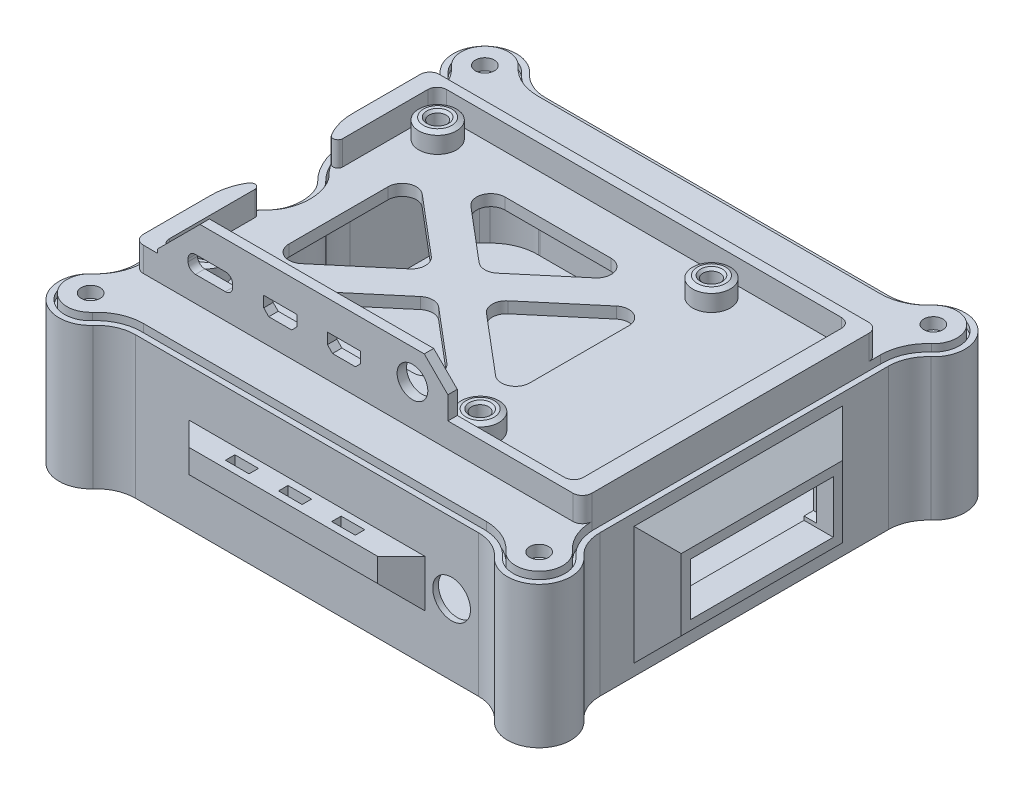
from build123d import *
from OCP.BRepFilletAPI import BRepFilletAPI_MakeChamfer

# Parameters (mm, degrees)
SKETCH2_W                = 95
SKETCH2_H                = 83.5
BACKPLATE_DEPTH          = 2.4
SKETCH4_R                = 5
BOSS_EXTRUDE2_DEPTH      = 2.4
FILLET1_R                = 10
CUT_EXTRUDE2_DEPTH       = 79.841676796
FILLET2_R                = 3
SKETCH7_R                = 4
SKETCH7_R_2              = 1.8
MOUNT_BUMP_DEPTH         = 4
MOUNT_HOLES_DEPTH        = 79.906590346
MOUNT_HOLES_DEPTH_BACK   = 79.906590346
SKETCH7_3_R              = 1.8
OUTER_CHAMFER_SIZE       = 0.5
OUTER_CHAMFER_SIZE2      = 1
INNER_CHAMFER_SIZE       = 0.5
CUT_EXTRUDE4_DEPTH       = 79.906590346
FILLET3_R                = 12
BOSS_EXTRUDE3_DEPTH      = 30
CUT_EXTRUDE5_DEPTH       = 28.4
BOSS_EXTRUDE4_DEPTH      = 27.2
FILLET5_R                = 10
CASING_HOLES_DEPTH       = 88.415616621
CASING_HOLES_DEPTH_BACK  = 88.415616621
SKETCH5_R                = 2
SKETCH12_W               = 34.2
SKETCH12_H               = 15.1
BOSS_EXTRUDE5_DEPTH      = 5
CHAMFER1_SIZE            = 5
CUT_EXTRUDE6_DEPTH       = 5
CUT_EXTRUDE6_DEPTH_BACK  = 1.2
SKETCH12_3_W             = 30.2
SKETCH12_3_H             = 11.1
SKETCH13_W               = 50
SKETCH13_H               = 10
BOSS_EXTRUDE6_DEPTH      = 5
CHAMFER3_SIZE            = 5
SKETCH14_W               = 5
SKETCH14_H               = 2
CUT_EXTRUDE7_DEPTH       = 84.616565505
SKETCH15_R               = 4
CUT_EXTRUDE8_DEPTH       = 1.2
SKETCH19_W               = 61.5
SKETCH19_H               = 2
BOSS_EXTRUDE12_DEPTH     = 15
CUT_EXTRUDE9_DEPTH       = 115.706931076
CUT_EXTRUDE9_DEPTH_BACK  = 115.706931076
SKETCH18_R               = 3
SKETCH18_R_2             = 3.25
CHAMFER4_SIZE            = 9
CHAMFER5_SIZE            = 5
BOSS_EXTRUDE13_DEPTH     = 27.2
FILLET7_R                = 2
BOSS_EXTRUDE22_DEPTH     = 5.2
FILLET8_R                = 1
FILLET9_R                = 2
MIRROR4_START            = -15.1686
MIRROR4_OUTLINE_W        = 5
MIRROR4_OUTLINE_H        = 2
MIRROR4_DEPTH            = 5.1686
MIRROR4_START_2          = -20
MIRROR4_2_OUTLINE_W      = 5
MIRROR4_2_OUTLINE_H      = 2
MIRROR4_2_DEPTH          = 4.8314
MIRROR4_START_3          = -50
MIRROR4_3_DEPTH          = 4.250191257
SKETCH23_W               = 1.7
SKETCH23_H               = 7.5
CUT_EXTRUDE10_DEPTH      = 1
CHAMFER6_SIZE            = 1
CHAMFER6_OF_MIRROR6_SIZE = 1
CHAMFER7_SIZE            = 1


with BuildPart() as part:
    # Sketch2 → Backplate (new body)
    with BuildSketch(Plane(origin=(0, 0, 0), x_dir=(1, 0, 0), z_dir=(0, 1, 0))):
        with Locations((10, 1.25)):
            Rectangle(SKETCH2_W, SKETCH2_H)
    extrude(amount=BACKPLATE_DEPTH)

    # Sketch4 → Boss-Extrude2 (add)
    with BuildSketch(Plane(origin=(0, 2.4, 0), x_dir=(1, 0, 0), z_dir=(0, 1, 0))):
        with Locations((-37.5, 43)):
            Circle(SKETCH4_R)
        with Locations((-37.5, -40.5)):
            Circle(SKETCH4_R)
        with Locations((57.5, -40.5)):
            Circle(SKETCH4_R)
        with Locations((57.5, 43)):
            Circle(SKETCH4_R)
    extrude(amount=-BOSS_EXTRUDE2_DEPTH)

    # Fillet1
    fillet1_edges = [part.edges().sort_by_distance(p)[0] for p in [
        (57.5, 1.2, -38),
        (52.5, 1.2, -43),
        (-32.5, 1.2, -43),
        (-37.5, 1.2, -38),
        (-32.5, 1.2, 40.5),
        (-37.5, 1.2, 35.5),
        (52.5, 1.2, 40.5),
        (57.5, 1.2, 35.5),
    ]]
    fillet(fillet1_edges, radius=FILLET1_R)

    # Sketch6 → Cut-Extrude2 (cut, through all)
    with BuildSketch(Plane(origin=(0, 2.4, 0), x_dir=(1, 0, 0), z_dir=(0, 1, 0))):
        Polygon((19.433743065, 21), (0, 4.581837755), (-19.433743065, 21), align=None)
        Polygon((-25.5, 16.961265693), (-5.423399792, 0), (-25.5, -16.961265693), align=None)
        Polygon((19.433743065, -21), (-19.433743065, -21), (0, -4.581837755), align=None)
        Polygon((25.5, 16.961265693), (25.5, -16.961265693), (5.423399792, 0), align=None)
    extrude(amount=-CUT_EXTRUDE2_DEPTH, mode=Mode.SUBTRACT)

    # Fillet2
    fillet2_edges = [part.edges().sort_by_distance(p)[0] for p in [
        (0, 1.2, 4.581837755),
        (19.433743065, 1.2, 21),
        (-19.433743065, 1.2, 21),
        (-25.5, 1.2, 16.961265693),
        (-25.5, 1.2, -16.961265693),
        (-5.423399792, 1.2, 0),
        (5.423399792, 1.2, 0),
        (25.5, 1.2, -16.961265693),
        (25.5, 1.2, 16.961265693),
        (-19.433743065, 1.2, -21),
        (19.433743065, 1.2, -21),
        (0, 1.2, -4.581837755),
    ]]
    fillet(fillet2_edges, radius=FILLET2_R)

    # Sketch7 → Mount Bump (add)
    # profile 1 of 8: a face of its own
    with BuildSketch(Plane(origin=(0, 2.4, 0), x_dir=(1, 0, 0), z_dir=(0, 1, 0))):
        with Locations(Location((-29, 24.5, 0), (0, 0, 270))):
            Circle(SKETCH7_R)
        with Locations((-29, 24.5)):
            Circle(SKETCH7_R_2, mode=Mode.SUBTRACT)
    # profile 2 of 8: a face of its own
    with BuildSketch(Plane(origin=(0, 2.4, 0), x_dir=(1, 0, 0), z_dir=(0, 1, 0))):
        with Locations((-29, 24.5)):
            Circle(SKETCH7_R_2)
    # profile 3 of 8: a face of its own
    with BuildSketch(Plane(origin=(0, 2.4, 0), x_dir=(1, 0, 0), z_dir=(0, 1, 0))):
        with Locations(Location((29, 24.5, 0), (0, 0, 270))):
            Circle(SKETCH7_R)
        with Locations((29, 24.5)):
            Circle(SKETCH7_R_2, mode=Mode.SUBTRACT)
    # profile 4 of 8: a face of its own
    with BuildSketch(Plane(origin=(0, 2.4, 0), x_dir=(1, 0, 0), z_dir=(0, 1, 0))):
        with Locations((29, 24.5)):
            Circle(SKETCH7_R_2)
    # profile 5 of 8: a face of its own
    with BuildSketch(Plane(origin=(0, 2.4, 0), x_dir=(1, 0, 0), z_dir=(0, 1, 0))):
        with Locations(Location((29, -24.5, 0), (0, 0, 270))):
            Circle(SKETCH7_R)
        with Locations((29, -24.5)):
            Circle(SKETCH7_R_2, mode=Mode.SUBTRACT)
    # profile 6 of 8: a face of its own
    with BuildSketch(Plane(origin=(0, 2.4, 0), x_dir=(1, 0, 0), z_dir=(0, 1, 0))):
        with Locations((29, -24.5)):
            Circle(SKETCH7_R_2)
    # profile 7 of 8: a face of its own
    with BuildSketch(Plane(origin=(0, 2.4, 0), x_dir=(1, 0, 0), z_dir=(0, 1, 0))):
        with Locations(Location((-29, -24.5, 0), (0, 0, 270))):
            Circle(SKETCH7_R)
        with Locations((-29, -24.5)):
            Circle(SKETCH7_R_2, mode=Mode.SUBTRACT)
    # profile 8 of 8: a face of its own
    with BuildSketch(Plane(origin=(0, 2.4, 0), x_dir=(1, 0, 0), z_dir=(0, 1, 0))):
        with Locations((-29, -24.5)):
            Circle(SKETCH7_R_2)
    extrude(amount=MOUNT_BUMP_DEPTH)

    # Sketch7<3> → Mount Holes (cut, two sides: drawn at the far end of the back side and taken through both)
    with BuildSketch(Plane(origin=(0, 2.4, 0), x_dir=(1, 0, 0), z_dir=(0, 1, 0)).offset(-MOUNT_HOLES_DEPTH_BACK)):
        with Locations(Location((-29, 24.5, 0), (0, 0, 270))):
            Circle(SKETCH7_3_R)
        with Locations(Location((29, 24.5, 0), (0, 0, 270))):
            Circle(SKETCH7_3_R)
        with Locations(Location((-29, -24.5, 0), (0, 0, 270))):
            Circle(SKETCH7_3_R)
        with Locations(Location((29, -24.5, 0), (0, 0, 270))):
            Circle(SKETCH7_3_R)
    extrude(amount=MOUNT_HOLES_DEPTH + MOUNT_HOLES_DEPTH_BACK, mode=Mode.SUBTRACT)

    # Outer Chamfer: one chamfer whose edges measure the first distance from different faces: ONE call of the kernel's chamfer builder (chamfer() names one face for all edges)
    outer_chamfer_edges_1 = [part.edges().sort_by_distance(p)[0] for p in [
        (-29, 6.4, -28.5),
    ]]
    outer_chamfer_side_1 = [part.faces().sort_by_distance(p)[0] for p in [
        (-29, 4.4, -28.5),
    ]]
    outer_chamfer_edges_2 = [part.edges().sort_by_distance(p)[0] for p in [
        (29, 6.4, -28.5),
    ]]
    outer_chamfer_side_2 = [part.faces().sort_by_distance(p)[0] for p in [
        (29, 4.4, -28.5),
    ]]
    outer_chamfer_edges_3 = [part.edges().sort_by_distance(p)[0] for p in [
        (29, 6.4, 20.5),
    ]]
    outer_chamfer_side_3 = [part.faces().sort_by_distance(p)[0] for p in [
        (29, 4.4, 20.5),
    ]]
    outer_chamfer_edges_4 = [part.edges().sort_by_distance(p)[0] for p in [
        (-29, 6.4, 20.5),
    ]]
    outer_chamfer_side_4 = [part.faces().sort_by_distance(p)[0] for p in [
        (-29, 4.4, 20.5),
    ]]
    outer_chamfer = BRepFilletAPI_MakeChamfer(part.part.solid().wrapped)
    for e in outer_chamfer_edges_1:
        outer_chamfer.Add(OUTER_CHAMFER_SIZE, OUTER_CHAMFER_SIZE2, e.wrapped, outer_chamfer_side_1[0].wrapped)  # the first distance lies on this face
    for e in outer_chamfer_edges_2:
        outer_chamfer.Add(OUTER_CHAMFER_SIZE, OUTER_CHAMFER_SIZE2, e.wrapped, outer_chamfer_side_2[0].wrapped)  # the first distance lies on this face
    for e in outer_chamfer_edges_3:
        outer_chamfer.Add(OUTER_CHAMFER_SIZE, OUTER_CHAMFER_SIZE2, e.wrapped, outer_chamfer_side_3[0].wrapped)  # the first distance lies on this face
    for e in outer_chamfer_edges_4:
        outer_chamfer.Add(OUTER_CHAMFER_SIZE, OUTER_CHAMFER_SIZE2, e.wrapped, outer_chamfer_side_4[0].wrapped)  # the first distance lies on this face
    add(Compound.cast(outer_chamfer.Shape()), mode=Mode.REPLACE)

    # Inner Chamfer
    inner_chamfer_edges = [part.edges().sort_by_distance(p)[0] for p in [
        (29, 6.4, -26.3),
        (-29, 6.4, 22.7),
        (29, 6.4, 22.7),
        (-29, 6.4, -26.3),
    ]]
    chamfer(inner_chamfer_edges, length=INNER_CHAMFER_SIZE)

    # Sketch8 → Cut-Extrude4 (cut, through all)
    with BuildSketch(Plane(origin=(0, 2.4, 0), x_dir=(1, 0, 0), z_dir=(0, 1, 0))):
        with BuildLine():
            Line((-37.5, 8), (-37.5, -8))
            add(Edge.make_bspline(
                [(-37.5, -8), (-31.5, -8), (-31.5, 0), (-31.5, 8), (-37.5, 8)],
                knots=[0, 0, 0, 1.570796327, 1.570796327, 3.141592654, 3.141592654, 3.141592654], degree=2, weights=[1, 0.707106781, 1, 0.707106781, 1]))
        make_face()
    extrude(amount=-CUT_EXTRUDE4_DEPTH, mode=Mode.SUBTRACT)

    # Fillet3
    fillet3_edges = [part.edges().sort_by_distance(p)[0] for p in [
        (-37.5, 1.2, -8),
        (-37.5, 1.2, 8),
    ]]
    fillet(fillet3_edges, radius=FILLET3_R)

    # Sketch9 → Boss-Extrude3 (add)
    with BuildSketch(Plane.XZ):
        with BuildLine():
            Line((-39.2, 29.319660113), (-39.2, 14.970010512))
            ThreePointArc((-39.2, 14.970010512), (-38.140047632, 9.68614868), (-35.124204984, 5.219898798))
            add(Edge.make_bspline(
                [(-35.124204984, 5.219898798), (-34.800075465, 4.899954882), (-34.247609195, 4.179715717), (-33.435428649, 2.439932761), (-33.042652724, -0.003661849), (-33.436614863, -2.441235626), (-34.245704751, -4.176554892), (-34.7995401, -4.89942643), (-35.124204984, -5.219898798)],
                knots=[0, 0, 0, 0, 0.125, 0.25, 0.5, 0.75, 0.875, 1, 1, 1, 1], degree=3))
            ThreePointArc((-35.124204984, -5.219898798), (-38.140047632, -9.68614868), (-39.2, -14.970010512))
            Line((-39.2, -14.970010512), (-39.2, -31.819660113))
            ThreePointArc((-39.2, -31.819660113), (-39.923171288, -35.208120923), (-41.966666667, -38.00611485))
            ThreePointArc((-41.966666667, -38.00611485), (-42.237615434, -47.737615434), (-32.50611485, -47.466666667))
            ThreePointArc((-32.50611485, -47.466666667), (-29.708120923, -45.423171288), (-26.319660113, -44.7))
            Line((-26.319660113, -44.7), (46.319660113, -44.7))
            ThreePointArc((46.319660113, -44.7), (49.708120923, -45.423171288), (52.50611485, -47.466666667))
            ThreePointArc((52.50611485, -47.466666667), (62.237615434, -47.737615434), (61.966666667, -38.00611485))
            ThreePointArc((61.966666667, -38.00611485), (59.923171288, -35.208120923), (59.2, -31.819660113))
            Line((59.2, -31.819660113), (59.2, 29.319660113))
            ThreePointArc((59.2, 29.319660113), (59.923171288, 32.708120923), (61.966666667, 35.50611485))
            ThreePointArc((61.966666667, 35.50611485), (62.237615434, 45.237615434), (52.50611485, 44.966666667))
            ThreePointArc((52.50611485, 44.966666667), (49.708120923, 42.923171288), (46.319660113, 42.2))
            Line((46.319660113, 42.2), (-26.319660113, 42.2))
            ThreePointArc((-26.319660113, 42.2), (-29.708120923, 42.923171288), (-32.50611485, 44.966666667))
            ThreePointArc((-32.50611485, 44.966666667), (-42.237615434, 45.237615434), (-41.966666667, 35.50611485))
            ThreePointArc((-41.966666667, 35.50611485), (-39.923171288, 32.708120923), (-39.2, 29.319660113))
        make_face()
    extrude(amount=BOSS_EXTRUDE3_DEPTH)

    # Sketch9<3> → Cut-Extrude5 (cut)
    with BuildSketch(Plane.XZ):
        with BuildLine():
            Line((-38, 29.319660113), (-38, 14.970010512))
            ThreePointArc((-38, 14.970010512), (-37.032890175, 10.148968694), (-34.281208927, 6.073923182))
            add(Edge.make_bspline(
                [(-34.281208927, 6.073923182), (-33.882070628, 5.679939101), (-33.545489342, 5.239618892), (-33.113386916, 4.525238038), (-32.981566085, 4.277171227), (-32.746116399, 3.774543475), (-32.641660281, 3.518752112), (-32.364531222, 2.739149193), (-32.22763268, 2.202975888), (-32.04415127, 1.101320172), (-31.999848962, 0.549657796), (-32.000076092, -0.279008786), (-32.011374122, -0.555428398), (-32.056930017, -1.108671524), (-32.091443397, -1.386707431), (-32.228986281, -2.208162731), (-32.365303217, -2.74136978), (-32.641407613, -3.518016876), (-32.745484197, -3.773005152), (-32.980179564, -4.274398454), (-33.111704673, -4.522262411), (-33.544657767, -5.238630125), (-33.881819308, -5.679691026), (-34.281208927, -6.073923182)],
                knots=[0, 0, 0, 0, 0.125, 0.125, 0.1875, 0.1875, 0.25, 0.25, 0.375, 0.375, 0.5, 0.5, 0.5625, 0.5625, 0.625, 0.625, 0.75, 0.75, 0.8125, 0.8125, 0.875, 0.875, 1, 1, 1, 1], degree=3))
            ThreePointArc((-34.281208927, -6.073923182), (-37.032890175, -10.148968694), (-38, -14.970010512))
            Line((-38, -14.970010512), (-38, -31.819660113))
            ThreePointArc((-38, -31.819660113), (-38.827726173, -35.698018872), (-41.166666667, -38.900542041))
            ThreePointArc((-41.166666667, -38.900542041), (-41.389087297, -46.889087297), (-33.400542041, -46.666666667))
            ThreePointArc((-33.400542041, -46.666666667), (-30.198018872, -44.327726173), (-26.319660113, -43.5))
            Line((-26.319660113, -43.5), (46.319660113, -43.5))
            ThreePointArc((46.319660113, -43.5), (50.198018872, -44.327726173), (53.400542041, -46.666666667))
            ThreePointArc((53.400542041, -46.666666667), (61.389087297, -46.889087297), (61.166666667, -38.900542041))
            ThreePointArc((61.166666667, -38.900542041), (58.827726173, -35.698018872), (58, -31.819660113))
            Line((58, -31.819660113), (58, 29.319660113))
            ThreePointArc((58, 29.319660113), (58.827726173, 33.198018872), (61.166666667, 36.400542041))
            ThreePointArc((61.166666667, 36.400542041), (61.389087297, 44.389087297), (53.400542041, 44.166666667))
            ThreePointArc((53.400542041, 44.166666667), (50.198018872, 41.827726173), (46.319660113, 41))
            Line((46.319660113, 41), (-26.319660113, 41))
            ThreePointArc((-26.319660113, 41), (-30.198018872, 41.827726173), (-33.400542041, 44.166666667))
            ThreePointArc((-33.400542041, 44.166666667), (-41.389087297, 44.389087297), (-41.166666667, 36.400542041))
            ThreePointArc((-41.166666667, 36.400542041), (-38.827726173, 33.198018872), (-38, 29.319660113))
        make_face()
    extrude(amount=CUT_EXTRUDE5_DEPTH, mode=Mode.SUBTRACT)


with BuildPart() as cut_extrude5_piece_1:
    # of the separate pieces the step leaves, piece 1, a body of its own (cut_extrude5_pieces)
    add(part.part.solids().sort_by_distance((52.50611485, 0, -47.466666667))[0])

    # Sketch10 → Boss-Extrude4 (add)
    with BuildSketch(Plane(origin=(0, -28.4, 0), x_dir=(1, 0, 0), z_dir=(0, 1, 0))):
        with BuildLine():
            Line((-38.827726173, 35.698018872), (-30.198018872, 44.327726173))
            ThreePointArc((-30.198018872, 44.327726173), (-31.92268606, 45.328227048), (-33.400542041, 46.666666667))
            ThreePointArc((-33.400542041, 46.666666667), (-41.389087297, 46.889087297), (-41.166666667, 38.900542041))
            ThreePointArc((-41.166666667, 38.900542041), (-39.828227048, 37.42268606), (-38.827726173, 35.698018872))
        make_face()
        with BuildLine():
            ThreePointArc((53.400542041, 46.666666667), (51.92268606, 45.328227048), (50.198018872, 44.327726173))
            Line((50.198018872, 44.327726173), (58.827726173, 35.698018872))
            ThreePointArc((58.827726173, 35.698018872), (59.828227048, 37.42268606), (61.166666667, 38.900542041))
            ThreePointArc((61.166666667, 38.900542041), (61.389087297, 46.889087297), (53.400542041, 46.666666667))
        make_face()
        with BuildLine():
            ThreePointArc((61.166666667, -36.400542041), (59.828227048, -34.92268606), (58.827726173, -33.198018872))
            Line((58.827726173, -33.198018872), (50.198018872, -41.827726173))
            ThreePointArc((50.198018872, -41.827726173), (51.92268606, -42.828227048), (53.400542041, -44.166666667))
            ThreePointArc((53.400542041, -44.166666667), (61.389087297, -44.389087297), (61.166666667, -36.400542041))
        make_face()
        with BuildLine():
            Line((-30.198018872, -41.827726173), (-38.827726173, -33.198018872))
            ThreePointArc((-38.827726173, -33.198018872), (-39.828227048, -34.92268606), (-41.166666667, -36.400542041))
            ThreePointArc((-41.166666667, -36.400542041), (-41.389087297, -44.389087297), (-33.400542041, -44.166666667))
            ThreePointArc((-33.400542041, -44.166666667), (-31.92268606, -42.828227048), (-30.198018872, -41.827726173))
        make_face()
    extrude(amount=BOSS_EXTRUDE4_DEPTH)

    # Fillet5
    fillet5_edges = [cut_extrude5_piece_1.edges().sort_by_distance(p)[0] for p in [
        (50.198018872, -14.8, 41.827726173),
        (58.827726173, -14.8, 33.198018872),
        (-38.827726173, -14.8, 33.198018872),
        (-30.198018872, -14.8, 41.827726173),
        (-30.198018872, -14.8, -44.327726173),
        (-38.827726173, -14.8, -35.698018872),
        (58.827726173, -14.8, -35.698018872),
        (50.198018872, -14.8, -44.327726173),
    ]]
    fillet(fillet5_edges, radius=FILLET5_R)


with BuildPart() as cut_extrude5_piece_2:
    # of the separate pieces the step leaves, piece 2, a body of its own (cut_extrude5_pieces)
    add(part.part.solids().sort_by_distance((-37.5, 2.4, 14.970010512))[0])


with BuildPart() as casing_holes_tool:
    # Sketch5 → Casing Holes (new, two sides: drawn at the far end of the back side and taken through both)
    with BuildSketch(Plane.XZ.offset(-2.4).offset(-CASING_HOLES_DEPTH_BACK)):
        with Locations(Location((-37.5, 40.5, 0), (0, 0, 270))):
            Circle(SKETCH5_R)
        with Locations(Location((57.5, 40.5, 0), (0, 0, 270))):
            Circle(SKETCH5_R)
        with Locations(Location((57.5, -43, 0), (0, 0, 270))):
            Circle(SKETCH5_R)
        with Locations(Location((-37.5, -43, 0), (0, 0, 270))):
            Circle(SKETCH5_R)
    extrude(amount=CASING_HOLES_DEPTH + CASING_HOLES_DEPTH_BACK)


with BuildPart() as cut_extrude5_piece_1_1:
    add(cut_extrude5_piece_1.part)

    # Casing Holes: cut by casing_holes_tool
    add(casing_holes_tool.part, mode=Mode.SUBTRACT)

    # Sketch12 → Boss-Extrude5 (add)
    with BuildSketch(Plane(origin=(59.2, 0, 0), x_dir=(0, 0, -1), z_dir=(1, 0, 0))):
        with Locations((0, -15)):
            Rectangle(SKETCH12_W, SKETCH12_H)
    extrude(amount=BOSS_EXTRUDE5_DEPTH)

    # Chamfer1
    chamfer1_edges = [cut_extrude5_piece_1_1.edges().sort_by_distance(p)[0] for p in [
        (59.2, -22.55, 0),
        (59.2, -15, -17.1),
        (59.2, -15, 17.1),
        (59.2, -7.45, 0),
    ]]
    chamfer(chamfer1_edges, length=CHAMFER1_SIZE - 0.0001)  # a hair under: the kernel refuses the full size

    # Sketch12<3> → Cut-Extrude6 (cut, two sides: drawn at the far end of the back side and taken through both)
    with BuildSketch(Plane(origin=(59.2, 0, 0), x_dir=(0, 0, -1), z_dir=(1, 0, 0)).offset(-CUT_EXTRUDE6_DEPTH_BACK)):
        with Locations((0, -15)):
            Rectangle(SKETCH12_3_W, SKETCH12_3_H)
    extrude(amount=CUT_EXTRUDE6_DEPTH + CUT_EXTRUDE6_DEPTH_BACK, mode=Mode.SUBTRACT)

    # Sketch13 → Boss-Extrude6 (add)
    with BuildSketch(Plane.XY.offset(42.2)):
        with Locations((10, -15)):
            Rectangle(SKETCH13_W, SKETCH13_H)
    extrude(amount=BOSS_EXTRUDE6_DEPTH)

    # Chamfer3
    chamfer3_edges = [cut_extrude5_piece_1_1.edges().sort_by_distance(p)[0] for p in [
        (-15, -15, 47.2),
        (10, -20, 47.2),
        (35, -15, 47.2),
    ]]
    chamfer(chamfer3_edges, length=CHAMFER3_SIZE - 0.0001)  # a hair under: the kernel refuses the full size

    # Sketch14 → Cut-Extrude7 (cut, through all)
    with BuildSketch(Plane(origin=(0, -10, 0), x_dir=(1, 0, 0), z_dir=(0, 1, 0))):
        with Locations((-1.25, -44.7)):
            Rectangle(SKETCH14_W, SKETCH14_H)
        with Locations((10, -44.7)):
            Rectangle(SKETCH14_W, SKETCH14_H)
        with Locations((21.25, -44.7)):
            Rectangle(SKETCH14_W, SKETCH14_H)
    extrude(amount=-CUT_EXTRUDE7_DEPTH, mode=Mode.SUBTRACT)

    # Sketch15 → Cut-Extrude8 (cut)
    with BuildSketch(Plane.XY.offset(42.2)):
        with Locations((40.659830056, -15)):
            Circle(SKETCH15_R)
    extrude(amount=-CUT_EXTRUDE8_DEPTH, mode=Mode.SUBTRACT)

    # Sketch20 → Boss-Extrude13 (add)
    with BuildSketch(Plane(origin=(0, -28.4, 0), x_dir=(1, 0, 0), z_dir=(0, 1, 0))):
        Polygon((10, -42.2), (12.424871131, -38), (32.575128869, -38), (35, -42.2), align=None)
        Polygon((19.024872208, 43.5), (54.024872208, 43.5), (54.024872208, 40.5), (22.024872208, 40.5), align=None)
    extrude(amount=BOSS_EXTRUDE13_DEPTH)

    # Fillet7
    fillet7_edges = [cut_extrude5_piece_1_1.edges().sort_by_distance(p)[0] for p in [
        (22.024872208, -14.8, -40.5),
        (19.024872208, -14.8, -43.5),
    ]]
    fillet(fillet7_edges, radius=FILLET7_R)

    # Mirror4: read off the stored shape, not the designer's step
    # Mirror4 outline → Mirror4 (add)
    with BuildSketch(Plane(origin=(0, 0, 0), x_dir=(1, 0, 0), z_dir=(0, 1, 0)).offset(MIRROR4_START)):
        Polygon((35, 44.7), (30, 49.7), (-10, 49.7), (-15, 44.7), align=None)
        with Locations((-1.25, 47.2)):
            Rectangle(MIRROR4_OUTLINE_W, MIRROR4_OUTLINE_H, mode=Mode.SUBTRACT)
        with Locations((10, 47.2)):
            Rectangle(MIRROR4_OUTLINE_W, MIRROR4_OUTLINE_H, mode=Mode.SUBTRACT)
        with Locations((21.25, 47.2)):
            Rectangle(MIRROR4_OUTLINE_W, MIRROR4_OUTLINE_H, mode=Mode.SUBTRACT)
    extrude(amount=MIRROR4_DEPTH)

    # Mirror4 2 outline → Mirror4 2 (add)
    with BuildSketch(Plane(origin=(0, 0, 0), x_dir=(1, 0, 0), z_dir=(0, 1, 0)).offset(MIRROR4_START_2)):
        Polygon((30, 49.7), (-10, 49.7), (-15, 44.7), (35, 44.7), align=None)
        with Locations((-1.25, 47.2)):
            Rectangle(MIRROR4_2_OUTLINE_W, MIRROR4_2_OUTLINE_H, mode=Mode.SUBTRACT)
        with Locations((10, 47.2)):
            Rectangle(MIRROR4_2_OUTLINE_W, MIRROR4_2_OUTLINE_H, mode=Mode.SUBTRACT)
        with Locations((21.25, 47.2)):
            Rectangle(MIRROR4_2_OUTLINE_W, MIRROR4_2_OUTLINE_H, mode=Mode.SUBTRACT)
    extrude(amount=MIRROR4_2_DEPTH)

    # Mirror4 3 outline → Mirror4 3 (cut)
    with BuildSketch(Plane(origin=(0, 0, 0), x_dir=(1, 0, 0), z_dir=(0, 0.707106781186548, 0.707106781186547)).offset(MIRROR4_START_3)):
        Polygon((35, 17.465537495), (30, 24.536605307), (-10, 24.536605307), (-15, 17.465537495), align=None)
    extrude(amount=MIRROR4_3_DEPTH, mode=Mode.SUBTRACT)

    # Sketch23 → Cut-Extrude10 (cut)
    with BuildSketch(Plane.XY.offset(-15.1)):
        with Locations((58.85, -15)):
            Rectangle(SKETCH23_W, SKETCH23_H)
    cut_extrude10 = extrude(amount=-CUT_EXTRUDE10_DEPTH, mode=Mode.SUBTRACT)

    # Chamfer6
    chamfer6_edges = [cut_extrude5_piece_1_1.edges().sort_by_distance(p)[0] for p in [
        (58, -15, -16.1),
        (58, -11.25, -15.6),
        (58.85, -11.25, -15.1),
        (59.7, -15, -15.1),
        (58, -18.75, -15.6),
        (58.85, -18.75, -15.1),
    ]]
    chamfer(chamfer6_edges, length=CHAMFER6_SIZE - 0.0001)  # a hair under: the kernel refuses the full size

    # Mirror6: Cut-Extrude10 across plane
    add(cut_extrude10.mirror(Plane.XY), mode=Mode.SUBTRACT)

    # Chamfer6 of Mirror6
    chamfer6_of_mirror6_edges = [cut_extrude5_piece_1_1.edges().sort_by_distance(p)[0] for p in [
        (58, -15, 16.1),
        (58, -11.25, 15.6),
        (58.85, -11.25, 15.1),
        (59.7, -15, 15.1),
        (58, -18.75, 15.6),
        (58.85, -18.75, 15.1),
    ]]
    chamfer(chamfer6_of_mirror6_edges, length=CHAMFER6_OF_MIRROR6_SIZE - 0.0001)  # a hair under: the kernel refuses the full size

    # Chamfer7
    chamfer7_edges = [cut_extrude5_piece_1_1.edges().sort_by_distance(p)[0] for p in [
        (-37.5, -1.2, 42.5),
        (57.5, -1.2, 42.5),
        (57.5, -1.2, -41),
        (-37.5, -1.2, -41),
    ]]
    chamfer(chamfer7_edges, length=CHAMFER7_SIZE)


with BuildPart() as cut_extrude5_piece_2_1:
    add(cut_extrude5_piece_2.part)

    # Casing Holes: cut by casing_holes_tool
    add(casing_holes_tool.part, mode=Mode.SUBTRACT)


with BuildPart() as cut_extrude5_piece_2_2:
    # Body-Move/Copy1: read off the stored shape, not the designer's step
    # Body-Move/Copy1: moved
    add(cut_extrude5_piece_2_1.part.moved(Location((0, -1.2, 0))))

    # Sketch19 → Boss-Extrude12 (add)
    with BuildSketch(Plane(origin=(0, 1.2, 0), x_dir=(1, 0, 0), z_dir=(0, 1, 0))):
        with Locations((-1.75, -30.334812191)):
            Rectangle(SKETCH19_W, SKETCH19_H)
    extrude(amount=BOSS_EXTRUDE12_DEPTH)

    # Sketch18 → Cut-Extrude9 (cut, two sides: drawn at the far end of the back side and taken through both)
    with BuildSketch(Plane.XY.offset(40.5).offset(-CUT_EXTRUDE9_DEPTH_BACK)):
        with BuildLine():
            Line((-26.02, 8.66), (-26.02, 8.1))
            ThreePointArc((-26.02, 8.1), (-25.566015511, 7.003984489), (-24.47, 6.55))
            Line((-24.47, 6.55), (-18.13, 6.55))
            ThreePointArc((-18.13, 6.55), (-17.033984489, 7.003984489), (-16.58, 8.1))
            Line((-16.58, 8.1), (-16.58, 8.66))
            ThreePointArc((-16.58, 8.66), (-17.033984489, 9.756015511), (-18.13, 10.21))
            Line((-18.13, 10.21), (-24.47, 10.21))
            ThreePointArc((-24.47, 10.21), (-25.566015511, 9.756015511), (-26.02, 8.66))
        make_face()
        Polygon((-8.938332284, 6.55), (-10, 7.649389104), (-10, 9.95), (-3, 9.95), (-3, 7.649389104), (-4.061667716, 6.55), align=None)
        Polygon((9.438332284, 6.55), (10.5, 7.649389104), (10.5, 9.95), (3.5, 9.95), (3.5, 7.649389104), (4.561667716, 6.55), align=None)
        with Locations((21.5, 9.8)):
            Circle(SKETCH18_R)
        with Locations(Location((21.5, 9.8, 0), (0, 0, 180))):
            Circle(SKETCH18_R_2)
        Polygon((-9.75, 9.7), (-3.25, 9.7), (-3.25, 7.75039566), (-4.16778642, 6.8), (-8.83221358, 6.8), (-9.75, 7.75039566), align=None)
        with BuildLine():
            Line((-18.13, 9.96), (-24.47, 9.96))
            ThreePointArc((-24.47, 9.96), (-25.389238816, 9.579238816), (-25.77, 8.66))
            Line((-25.77, 8.66), (-25.77, 8.1))
            ThreePointArc((-25.77, 8.1), (-25.389238816, 7.180761184), (-24.47, 6.8))
            Line((-24.47, 6.8), (-18.13, 6.8))
            ThreePointArc((-18.13, 6.8), (-17.210761184, 7.180761184), (-16.83, 8.1))
            Line((-16.83, 8.1), (-16.83, 8.66))
            ThreePointArc((-16.83, 8.66), (-17.210761184, 9.579238816), (-18.13, 9.96))
        make_face()
    extrude(amount=CUT_EXTRUDE9_DEPTH + CUT_EXTRUDE9_DEPTH_BACK, mode=Mode.SUBTRACT)

    # Chamfer4
    chamfer4_edges = [cut_extrude5_piece_2_2.edges().sort_by_distance(p)[0] for p in [
        (-32.5, 16.2, 30.334812191),
    ]]
    chamfer(chamfer4_edges, length=CHAMFER4_SIZE)

    # Chamfer5
    chamfer5_edges = [cut_extrude5_piece_2_2.edges().sort_by_distance(p)[0] for p in [
        (29, 16.2, 30.334812191),
    ]]
    chamfer(chamfer5_edges, length=CHAMFER5_SIZE)

    # Sketch21 → Boss-Extrude22 (add)
    with BuildSketch(Plane(origin=(0, 1.2, 0), x_dir=(1, 0, 0), z_dir=(0, 1, 0))):
        with BuildLine():
            Line((-33.92996057, -31.334812191), (-37.5, -31.334812191))
            Line((-37.5, -31.334812191), (-37.5, -14.970010512))
            ThreePointArc((-37.5, -14.970010512), (-36.571574568, -10.341810367), (-33.92996057, -6.429766675))
            Line((-33.92996057, -6.429766675), (-33.92996057, -29.334812191))
            Line((-33.92996057, -29.334812191), (-32.5, -29.334812191))
            Line((-32.5, -29.334812191), (-32.5, -31.334812191))
            Line((-32.5, -31.334812191), (-33.92996057, -31.334812191))
        make_face()
        with BuildLine():
            Line((-33.92996057, 31.334812191), (53.7, 31.334812191))
            Line((53.7, 31.334812191), (57.5, 31.334812191))
            Line((57.5, 31.334812191), (57.5, -31.334812191))
            Line((57.5, -31.334812191), (29, -31.334812191))
            Line((29, -31.334812191), (29, -29.334812191))
            Line((29, -29.334812191), (53.7, -29.334812191))
            Line((53.7, -29.334812191), (53.7, 29.334812191))
            Line((53.7, 29.334812191), (-33.92996057, 29.334812191))
            Line((-33.92996057, 29.334812191), (-33.92996057, 6.429766675))
            ThreePointArc((-33.92996057, 6.429766675), (-36.571574568, 10.341810367), (-37.5, 14.970010512))
            Line((-37.5, 14.970010512), (-37.5, 31.334812191))
            Line((-37.5, 31.334812191), (-33.92996057, 31.334812191))
        make_face()
    extrude(amount=BOSS_EXTRUDE22_DEPTH)

    # Fillet8
    fillet8_edges = [cut_extrude5_piece_2_2.edges().sort_by_distance(p)[0] for p in [
        (-33.92996057, 3.8, 6.429766675),
        (-33.92996057, 3.8, -6.429766675),
    ]]
    fillet(fillet8_edges, radius=FILLET8_R)

    # Fillet9
    fillet9_edges = [cut_extrude5_piece_2_2.edges().sort_by_distance(p)[0] for p in [
        (57.5, 3.8, -31.334812191),
        (-37.5, 3.8, 31.334812191),
        (57.5, 3.8, 31.334812191),
        (53.7, 3.8, -29.334812191),
        (53.7, 3.8, 29.334812191),
        (-33.92996057, 3.8, 29.334812191),
        (-33.92996057, 3.8, -29.334812191),
        (-37.5, 3.8, -31.334812191),
    ]]
    fillet(fillet9_edges, radius=FILLET9_R)


solid = Compound([cut_extrude5_piece_1_1.part, cut_extrude5_piece_2_2.part])
